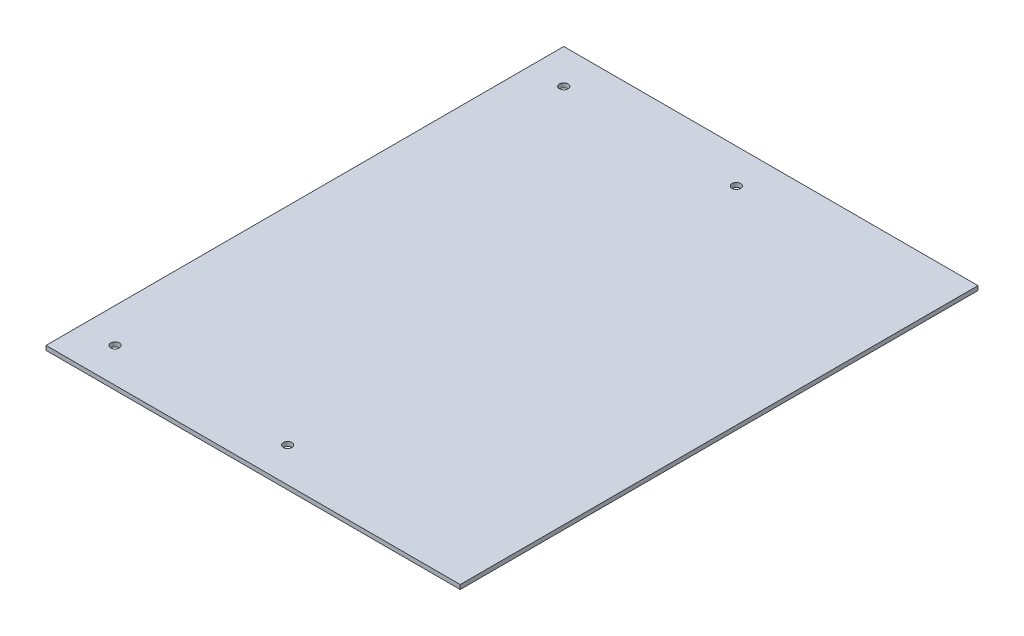
from build123d import *

# Parameters (mm, degrees)
SKETCH_1_W      = 152.4
SKETCH_1_H      = 190.5
SKETCH_1_R      = 1.5875
EXTRUDE_1_DEPTH = 1.5875


with BuildPart() as part:
    # 스케치1 → 보스-돌출1 (new body)
    with BuildSketch(Plane(origin=(0, 0, 0), x_dir=(1, 0, 0), z_dir=(0, 1, 0))):
        Rectangle(SKETCH_1_W, SKETCH_1_H)
        with Locations((-63.5, -82.55)):
            Circle(SKETCH_1_R, mode=Mode.SUBTRACT)
        with Locations((0, -82.55)):
            Circle(SKETCH_1_R, mode=Mode.SUBTRACT)
        with Locations((0, 82.55)):
            Circle(SKETCH_1_R, mode=Mode.SUBTRACT)
        with Locations((-63.5, 82.55)):
            Circle(SKETCH_1_R, mode=Mode.SUBTRACT)
    extrude(amount=EXTRUDE_1_DEPTH)


solid = part.part
